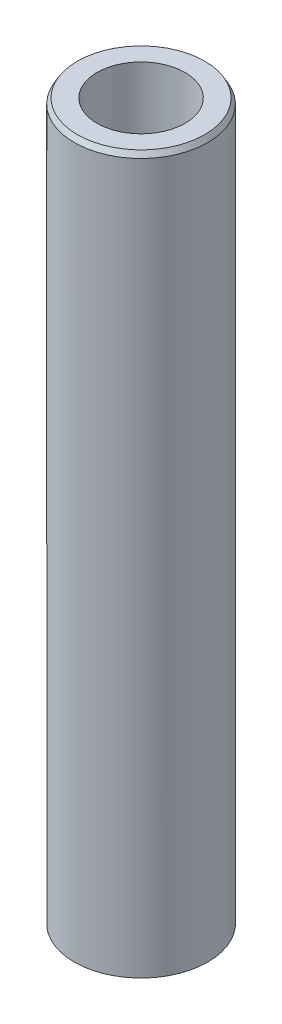
from build123d import *
from OCP.BRepFilletAPI import BRepFilletAPI_MakeChamfer

# Parameters (mm, degrees)
SKETCH1_R           = 40
BOSS_EXTRUDE1_DEPTH = 430.38274559
SKETCH2_R           = 26.397105534
CUT_EXTRUDE1_DEPTH  = 435.084447662
CHAMFER1_SIZE       = 3.185606973
CHAMFER1_SIZE2      = 1.839211043


with BuildPart() as part:
    # Sketch1 → Boss-Extrude1 (new body)
    with BuildSketch(Plane(origin=(0, 0, 0), x_dir=(1, 0, 0), z_dir=(0, 1, 0))):
        Circle(SKETCH1_R)
    extrude(amount=BOSS_EXTRUDE1_DEPTH)

    # Sketch2 → Cut-Extrude1 (cut, through all)
    with BuildSketch(Plane(origin=(0, 0, 0), x_dir=(1, 0, 0), z_dir=(0, 1, 0))):
        Circle(SKETCH2_R)
    extrude(amount=CUT_EXTRUDE1_DEPTH, mode=Mode.SUBTRACT)

    # Chamfer1: one chamfer whose edges measure the first distance from different faces: ONE call of the kernel's chamfer builder (chamfer() names one face for all edges)
    chamfer1_edges_1 = [part.edges().sort_by_distance(p)[0] for p in [
        (-40, 430.38274559, 0),
    ]]
    chamfer1_side_1 = [part.faces().sort_by_distance(p)[0] for p in [
        (-40, 215.191372795, 0),
    ]]
    chamfer1_edges_2 = [part.edges().sort_by_distance(p)[0] for p in [
        (-40, 0, 0),
    ]]
    chamfer1_side_2 = [part.faces().sort_by_distance(p)[0] for p in [
        (-38.86862915, 0, 0),
    ]]
    chamfer1 = BRepFilletAPI_MakeChamfer(part.part.solid().wrapped)
    for e in chamfer1_edges_1:
        chamfer1.Add(CHAMFER1_SIZE, CHAMFER1_SIZE2, e.wrapped, chamfer1_side_1[0].wrapped)  # the first distance lies on this face
    for e in chamfer1_edges_2:
        chamfer1.Add(CHAMFER1_SIZE, CHAMFER1_SIZE2, e.wrapped, chamfer1_side_2[0].wrapped)  # the first distance lies on this face
    add(Compound.cast(chamfer1.Shape()), mode=Mode.REPLACE)


solid = part.part
